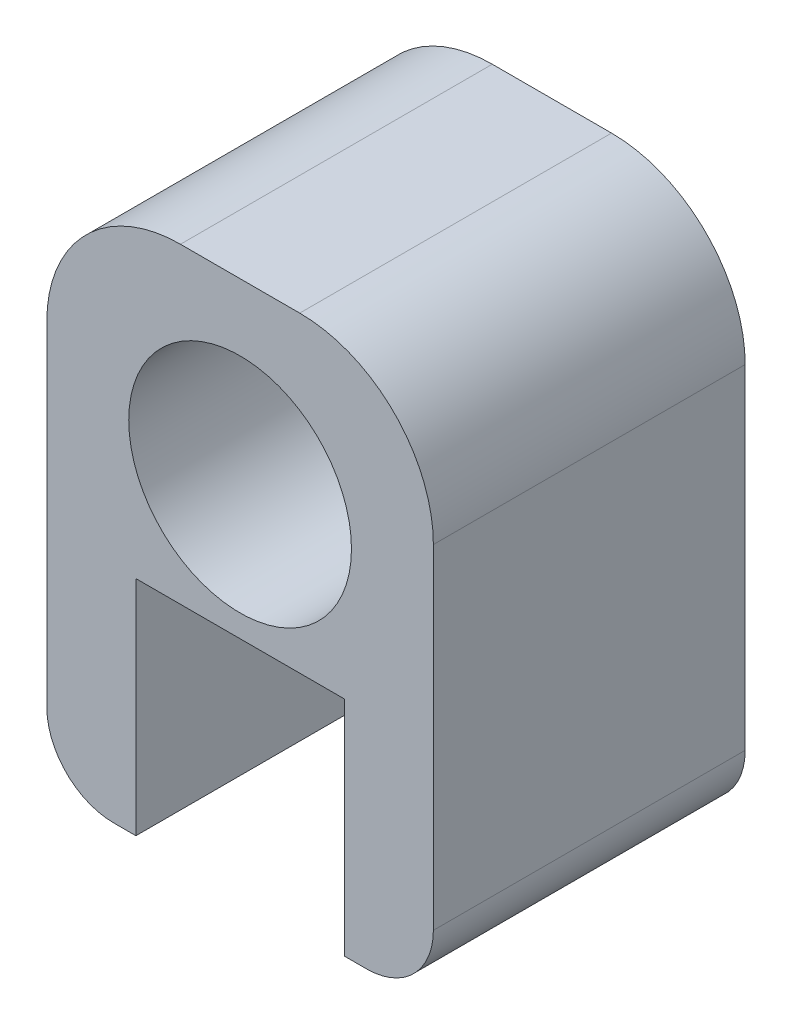
from build123d import *

# Parameters (mm, degrees)
BOSS_EXTRUDE1_DEPTH = 7
SKETCH5_R           = 2.5
CUT_EXTRUDE2_DEPTH  = 11.808583514
FILLET1_R           = 3
FILLET2_R           = 3
FILLET3_R           = 1.5
FILLET4_R           = 1.5


with BuildPart() as part:
    # Sketch1 → Boss-Extrude1 (new body)
    with BuildSketch(Plane.XY):
        Polygon((2.338833665, 0), (-2.338833665, 0), (-2.338833665, -5), (-4.338833665, -5), (-4.338833665, 7), (4.338833665, 7), (4.338833665, -5), (2.338833665, -5), align=None)
    extrude(amount=-BOSS_EXTRUDE1_DEPTH)

    # Sketch5 → Cut-Extrude2 (cut, through all)
    with BuildSketch(Plane.XY):
        with Locations((0, 3)):
            Circle(SKETCH5_R)
    extrude(amount=-CUT_EXTRUDE2_DEPTH, mode=Mode.SUBTRACT)

    # Fillet1
    fillet1_edges = [part.edges().sort_by_distance(p)[0] for p in [
        (4.338833665, 7, -3.5),
    ]]
    fillet(fillet1_edges, radius=FILLET1_R)

    # Fillet2
    fillet2_edges = [part.edges().sort_by_distance(p)[0] for p in [
        (-4.338833665, 7, -3.5),
    ]]
    fillet(fillet2_edges, radius=FILLET2_R)

    # Fillet3
    fillet3_edges = [part.edges().sort_by_distance(p)[0] for p in [
        (4.338833665, -5, -3.5),
    ]]
    fillet(fillet3_edges, radius=FILLET3_R)

    # Fillet4
    fillet4_edges = [part.edges().sort_by_distance(p)[0] for p in [
        (-4.338833665, -5, -3.5),
    ]]
    fillet(fillet4_edges, radius=FILLET4_R)


solid = part.part
